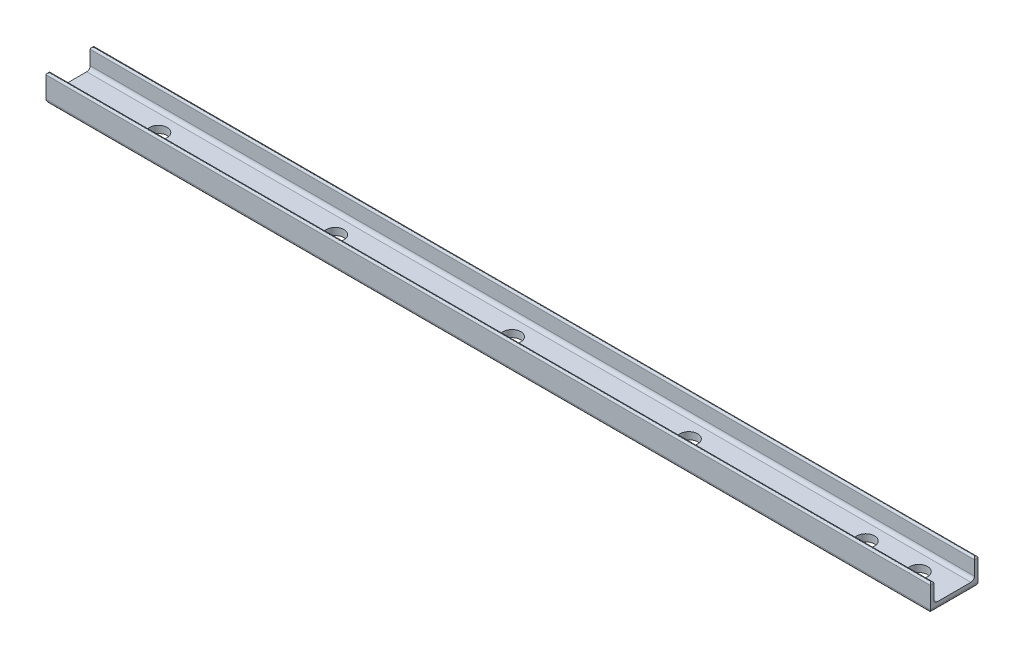
from build123d import *

# Parameters (mm, degrees)
SKETCH1_W           = 250
SKETCH1_H           = 13.5
SKETCH1_R           = 2.5
BOSS_EXTRUDE1_DEPTH = 2
SKETCH3_W           = 250
SKETCH3_H           = 1
BOSS_EXTRUDE2_DEPTH = 5.5
FILLET1_R           = 1
FILLET2_R           = 0.5


with BuildPart() as part:
    # Sketch1 → Boss-Extrude1 (new body)
    with BuildSketch(Plane(origin=(0, 0, 0), x_dir=(1, 0, 0), z_dir=(0, 1, 0))):
        Rectangle(SKETCH1_W, SKETCH1_H)
        with Locations(Location((0, 0, 0), (0, 0, 270))):
            Circle(SKETCH1_R, mode=Mode.SUBTRACT)
        with Locations(Location((-50, 0, 0), (0, 0, 270))):
            Circle(SKETCH1_R, mode=Mode.SUBTRACT)
        with Locations(Location((-100, 0, 0), (0, 0, 270))):
            Circle(SKETCH1_R, mode=Mode.SUBTRACT)
        with Locations(Location((50, 0, 0), (0, 0, 270))):
            Circle(SKETCH1_R, mode=Mode.SUBTRACT)
        with Locations(Location((100, 0, 0), (0, 0, 270))):
            Circle(SKETCH1_R, mode=Mode.SUBTRACT)
        with Locations(Location((115, 0, 0), (0, 0, 270))):
            Circle(SKETCH1_R, mode=Mode.SUBTRACT)
    extrude(amount=BOSS_EXTRUDE1_DEPTH)

    # Sketch3 → Boss-Extrude2 (add)
    with BuildSketch(Plane(origin=(0, 2, 0), x_dir=(1, 0, 0), z_dir=(0, 1, 0))):
        with Locations((0, 6.25)):
            Rectangle(SKETCH3_W, SKETCH3_H)
        with Locations((0, -6.25)):
            Rectangle(SKETCH3_W, SKETCH3_H)
    extrude(amount=BOSS_EXTRUDE2_DEPTH)

    # Fillet1
    fillet1_edges = [part.edges().sort_by_distance(p)[0] for p in [
        (0, 2, -5.75),
        (0, 0, 6.75),
        (0, 2, 5.75),
        (-125, 0, 0),
        (0, 0, -6.75),
        (125, 0, 0),
    ]]
    fillet(fillet1_edges, radius=FILLET1_R)

    # Fillet2
    fillet2_edges = [part.edges().sort_by_distance(p)[0] for p in [
        (-125, 7.5, -6.25),
        (0, 7.5, -5.75),
        (125, 7.5, -6.25),
        (0, 7.5, -6.75),
        (-125, 7.5, 6.25),
        (0, 7.5, 6.75),
        (125, 7.5, 6.25),
        (0, 7.5, 5.75),
    ]]
    fillet(fillet2_edges, radius=FILLET2_R - 0.0001)  # a hair under: the kernel refuses the full size


solid = part.part
